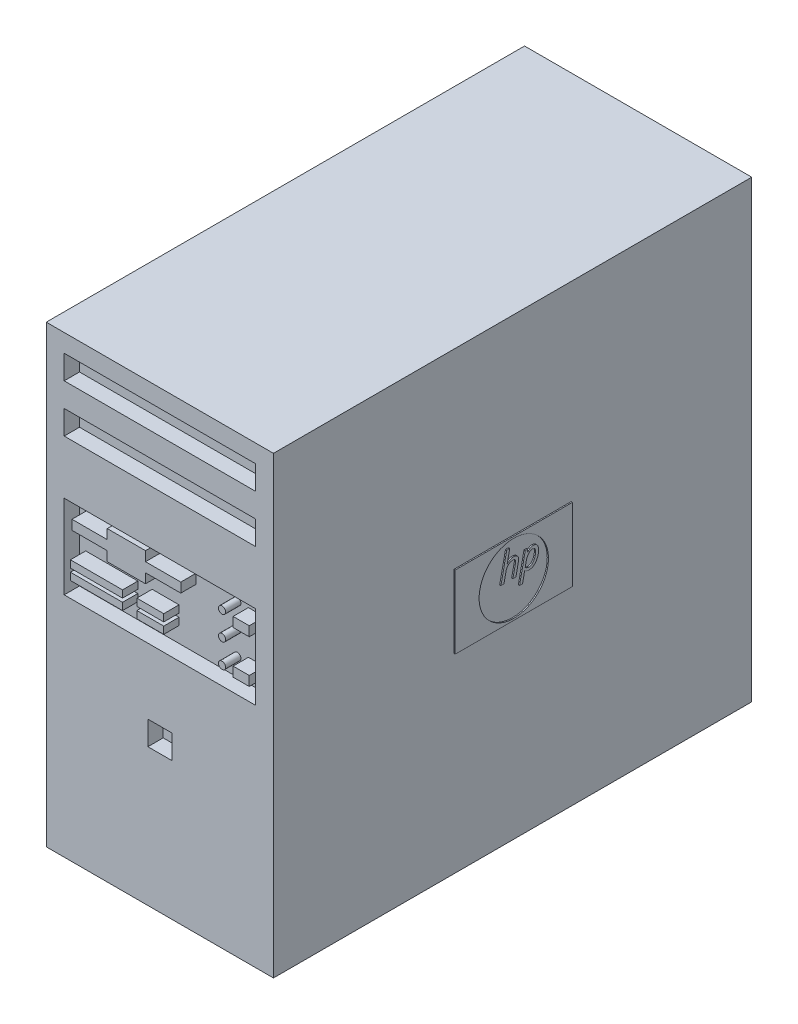
from build123d import *

# Parameters (mm, degrees)
CROQUIS1_W              = 400
CROQUIS1_H              = 380
SALIENTE_EXTRUIR1_DEPTH = 95
CROQUIS2_W              = 30.4
CROQUIS2_H              = 21.7
CROQUIS2_W_2            = 1
CROQUIS2_H_2            = 5
CORTAR_EXTRUIR1_DEPTH   = 14
CROQUIS3_W              = 45
CROQUIS3_H              = 150
CROQUIS3_W_2            = 100
CROQUIS3_H_2            = 15
SALIENTE_EXTRUIR2_DEPTH = 3
CROQUIS4_R              = 6.15
CROQUIS4_R_2            = 4
CROQUIS4_W              = 5
CROQUIS4_H              = 13
CROQUIS4_W_2            = 12
SALIENTE_EXTRUIR3_DEPTH = 5
CROQUIS5_R              = 4.1
CROQUIS5_R_2            = 5.55
SALIENTE_EXTRUIR4_DEPTH = 5
CROQUIS6_W              = 160
CROQUIS6_H              = 70
CROQUIS6_W_2            = 43.6
CROQUIS6_H_2            = 6
CROQUIS6_W_3            = 22.5
CROQUIS6_R              = 3
CROQUIS6_W_4            = 13.5
CROQUIS6_H_3            = 8
CROQUIS6_H_4            = 20
CROQUIS6_W_5            = 20
CORTAR_EXTRUIR2_DEPTH   = 12.8
ENVOLVER1_DEPTH         = 1
CROQUIS11_W             = 98
CROQUIS11_H             = 61
CROQUIS11_R             = 29
SALIENTE_EXTRUIR5_DEPTH = 1
ENVOLVER2_DEPTH         = 1
SALIENTE_EXTRUIR6_START = 1
CROQUIS13_W             = 98
CROQUIS13_H             = 61
CROQUIS13_R             = 29
SALIENTE_EXTRUIR6_DEPTH = 1


# Read off the part's stored shape, not the designer's step: Envolver1, Envolver2
with BuildPart() as part:
    # Croquis1 → Saliente-Extruir1 (new, symmetric)
    with BuildSketch(Plane(origin=(0, 0, 0), x_dir=(0, 0, -1), z_dir=(1, 0, 0))):
        Rectangle(CROQUIS1_W, CROQUIS1_H)
    extrude(amount=SALIENTE_EXTRUIR1_DEPTH, both=True)

    # Croquis2 → Cortar-Extruir1 (cut)
    # profile 1 of 5: a face of its own
    with BuildSketch(Plane(origin=(0, 0, -200), x_dir=(-1, 0, 0), z_dir=(0, 0, -1))):
        with Locations((-55, 160)):
            Rectangle(CROQUIS2_W, CROQUIS2_H)
        Polygon((-42, 151), (-68, 151), (-68, 160), (-68, 164.669872981), (-62.5, 169), (-47.5, 169), (-42, 164.669872981), (-42, 160), align=None, mode=Mode.SUBTRACT)
    # profile 2 of 5: a face of its own
    with BuildSketch(Plane(origin=(0, 0, -200), x_dir=(-1, 0, 0), z_dir=(0, 0, -1))):
        with Locations((-55, 162.856907895)):
            Rectangle(CROQUIS2_W_2, CROQUIS2_H_2)
    # profile 3 of 5: a face of its own
    with BuildSketch(Plane(origin=(0, 0, -200), x_dir=(-1, 0, 0), z_dir=(0, 0, -1))):
        with Locations((-48.5, 155)):
            Rectangle(CROQUIS2_W_2, CROQUIS2_H_2)
    # profile 4 of 5: a face of its own
    with BuildSketch(Plane(origin=(0, 0, -200), x_dir=(-1, 0, 0), z_dir=(0, 0, -1))):
        with Locations((-61.5, 155)):
            Rectangle(CROQUIS2_W_2, CROQUIS2_H_2)
    # profile 5 of 5: a face of its own
    with BuildSketch(Plane(origin=(0, 0, -200), x_dir=(-1, 0, 0), z_dir=(0, 0, -1))):
        Polygon((-85, 90), (-25, 90), (-25, -70), (30, -70), (30, -165), (-85, -165), align=None)
    extrude(amount=-CORTAR_EXTRUIR1_DEPTH, mode=Mode.SUBTRACT)

    # Croquis3 → Saliente-Extruir2 (add)
    with BuildSketch(Plane(origin=(0, 0, -186), x_dir=(-1, 0, 0), z_dir=(0, 0, -1))):
        with Locations((-58, 12.5)):
            Rectangle(CROQUIS3_W, CROQUIS3_H)
        with Locations((-22.5, -85)):
            Rectangle(CROQUIS3_W_2, CROQUIS3_H_2)
    extrude(amount=SALIENTE_EXTRUIR2_DEPTH)

    # Croquis4 → Saliente-Extruir3 (add)
    with BuildSketch(Plane(origin=(0, 0, -189), x_dir=(-1, 0, 0), z_dir=(0, 0, -1))):
        with Locations(Location((-69, 76, 0), (0, 0, 180))):
            Circle(CROQUIS4_R)
        with Locations(Location((-50, 76, 0), (0, 0, 180))):
            Circle(CROQUIS4_R)
        with Locations(Location((-68, -57.5, 0), (0, 0, 180))):
            Circle(CROQUIS4_R_2)
        with Locations(Location((-56, -57.5, 0), (0, 0, 180))):
            Circle(CROQUIS4_R_2)
        with Locations(Location((-43, -57.5, 0), (0, 0, 180))):
            Circle(CROQUIS4_R_2)
        with BuildLine():
            Line((-65.269265107, 53.441675937), (-70.469265107, 52.735154197))
            ThreePointArc((-70.469265107, 52.735154197), (-71.706408015, 52.068936991), (-72.2, 50.753363012))
            Line((-72.2, 50.753363012), (-72.2, 41.246636988))
            ThreePointArc((-72.2, 41.246636988), (-71.706408015, 39.931063009), (-70.469265107, 39.264845803))
            Line((-70.469265107, 39.264845803), (-65.269265107, 38.558324063))
            ThreePointArc((-65.269265107, 38.558324063), (-63.684426021, 39.033707234), (-63, 40.540115249))
            Line((-63, 40.540115249), (-63, 51.459884751))
            ThreePointArc((-63, 51.459884751), (-63.684426021, 52.966292766), (-65.269265107, 53.441675937))
        make_face()
        with BuildLine():
            Line((-52.36857707, 53.105891799), (-48.36857707, 53.855891799))
            ThreePointArc((-48.36857707, 53.855891799), (-46.722728326, 53.429165642), (-46, 51.890147425))
            Line((-46, 51.890147425), (-46, 16.709852575))
            ThreePointArc((-46, 16.709852575), (-46.722728326, 15.170834358), (-48.36857707, 14.744108201))
            Line((-48.36857707, 14.744108201), (-52.36857707, 15.494108201))
            ThreePointArc((-52.36857707, 15.494108201), (-53.539018216, 16.1825809), (-54, 17.459852575))
            Line((-54, 17.459852575), (-54, 51.140147425))
            ThreePointArc((-54, 51.140147425), (-53.539018216, 52.4174191), (-52.36857707, 53.105891799))
        make_face()
        with BuildLine():
            Line((-68.25, 23), (-70, 23))
            Line((-70, 23), (-70, 4))
            Line((-70, 4), (-68.25, 4))
            ThreePointArc((-68.25, 4), (-65, 0.75), (-61.75, 4))
            Line((-61.75, 4), (-60, 4))
            Line((-60, 4), (-60, 23))
            Line((-60, 23), (-61.75, 23))
            ThreePointArc((-61.75, 23), (-65, 26.25), (-68.25, 23))
        make_face()
        with Locations((-63, -13.5)):
            Rectangle(CROQUIS4_W, CROQUIS4_H)
        with Locations((-71, -13.5)):
            Rectangle(CROQUIS4_W, CROQUIS4_H)
        with Locations((-63, -40.5)):
            Rectangle(CROQUIS4_W, CROQUIS4_H)
        with Locations((-71, -40.5)):
            Rectangle(CROQUIS4_W, CROQUIS4_H)
        with BuildLine():
            Line((-46, -20.5), (-46, -6.5))
            Line((-46, -6.5), (-56, -6.5))
            Line((-56, -6.5), (-56, -20.5))
            ThreePointArc((-56, -20.5), (-51, -25.5), (-46, -20.5))
        make_face()
        with Locations((-50, -40.5)):
            Rectangle(CROQUIS4_W_2, CROQUIS4_H)
    extrude(amount=SALIENTE_EXTRUIR3_DEPTH)

    # Croquis5 → Saliente-Extruir4 (add)
    with BuildSketch(Plane(origin=(0, 0, -189), x_dir=(-1, 0, 0), z_dir=(0, 0, -1))):
        with Locations(Location((-13, -85, 0), (0, 0, 180))):
            Circle(CROQUIS5_R)
        with Locations(Location((-28, -85, 0), (0, 0, 180))):
            Circle(CROQUIS5_R_2)
        with BuildLine():
            Line((-54.378732187, -82.51492875), (-55.378732187, -86.51492875))
            ThreePointArc((-55.378732187, -86.51492875), (-55.014858063, -88.230824419), (-53.438447187, -89))
            Line((-53.438447187, -89), (-42.561552813, -89))
            ThreePointArc((-42.561552813, -89), (-40.985141937, -88.230824419), (-40.621267813, -86.51492875))
            Line((-40.621267813, -86.51492875), (-41.621267813, -82.51492875))
            ThreePointArc((-41.621267813, -82.51492875), (-42.330728394, -81.423589124), (-43.561552813, -81))
            Line((-43.561552813, -81), (-52.438447187, -81))
            ThreePointArc((-52.438447187, -81), (-53.669271606, -81.423589124), (-54.378732187, -82.51492875))
        make_face()
    extrude(amount=SALIENTE_EXTRUIR4_DEPTH)

    # Croquis6 → Cortar-Extruir2 (cut)
    # profile 1 of 4: a face of its own
    with BuildSketch(Plane.XY.offset(200)):
        with Locations((0, 35)):
            Rectangle(CROQUIS6_W, CROQUIS6_H)
        with Locations((-53, 16)):
            Rectangle(CROQUIS6_W_2, CROQUIS6_H_2, mode=Mode.SUBTRACT)
        with Locations((-53, 25)):
            Rectangle(CROQUIS6_W_2, CROQUIS6_H_2, mode=Mode.SUBTRACT)
        with Locations((-8, 16)):
            Rectangle(CROQUIS6_W_3, CROQUIS6_H_2, mode=Mode.SUBTRACT)
        with Locations((-8, 25)):
            Rectangle(CROQUIS6_W_3, CROQUIS6_H_2, mode=Mode.SUBTRACT)
        with Locations((52, 15)):
            Circle(CROQUIS6_R, mode=Mode.SUBTRACT)
        with Locations((68, 15)):
            Rectangle(CROQUIS6_W_4, CROQUIS6_H_3, mode=Mode.SUBTRACT)
        with Locations((52, 35)):
            Circle(CROQUIS6_R, mode=Mode.SUBTRACT)
        Polygon((17.5, 58), (17.5, 50), (-12, 50), (-12, 42), (-44, 42), (-44, 50), (-73.5, 50), (-73.5, 58), (-44, 58), (-44, 66), (-12, 66), (-12, 58), align=None, mode=Mode.SUBTRACT)
        with Locations((52, 55)):
            Circle(CROQUIS6_R, mode=Mode.SUBTRACT)
        with Locations((68, 51)):
            Rectangle(CROQUIS6_W_4, CROQUIS6_H_3, mode=Mode.SUBTRACT)
    # profile 2 of 4: a face of its own
    with BuildSketch(Plane.XY.offset(200)):
        with Locations((0, 165)):
            Rectangle(CROQUIS6_W, CROQUIS6_H_4)
    # profile 3 of 4: a face of its own
    with BuildSketch(Plane.XY.offset(200)):
        with Locations((0, 125)):
            Rectangle(CROQUIS6_W, CROQUIS6_H_4)
    # profile 4 of 4: a face of its own
    with BuildSketch(Plane.XY.offset(200)):
        with Locations((0, -65)):
            Rectangle(CROQUIS6_W_5, CROQUIS6_H_4)
    extrude(amount=-CORTAR_EXTRUIR2_DEPTH, mode=Mode.SUBTRACT)

    # Envolver1 outline → Envolver1 (add)
    # profile 1 of 2: a face of its own
    with BuildSketch(Plane.ZY.offset(95)):
        with BuildLine():
            add(Edge.make_bspline(
                [(7.181198595, 11.423049884), (7.337619147, 11.610028115), (7.6376853, 11.968713966), (8.140874147, 12.42272072), (8.641987971, 12.802255602), (9.155396307, 13.094519079), (9.667215756, 13.319715287), (10.181723883, 13.462802192), (10.685270473, 13.548973438), (11.017664645, 13.561747174), (11.180097426, 13.567989382)],
                knots=[0, 0, 0, 0, 0.155479612, 0.298261122, 0.43168685, 0.556135977, 0.674636922, 0.787784901, 0.896295749, 1, 1, 1, 1], degree=3))
            Line((7.181198595, 11.423049884), (7.127159422, 11.423049884))
            Line((7.127159422, 11.423049884), (7.127159422, 13.301950374))
            Line((7.127159422, 13.301950374), (5.3438667, 13.301950374))
            Line((5.3438667, 13.301950374), (1.220262084, -6.650975187))
            Line((1.220262084, -6.650975187), (3.394299598, -6.650975187))
            Line((3.394299598, -6.650975187), (4.936494469, 0.910352229))
            Line((4.936494469, 0.910352229), (4.994690502, 0.910352229))
            add(Edge.make_bspline(
                [(8.20794289, -0.266039007), (8.037368303, -0.261813107), (7.704892979, -0.253576197), (7.221505063, -0.196542189), (6.7684401, -0.094839664), (6.343961468, 0.03977446), (5.95457134, 0.215778471), (5.597588372, 0.416083364), (5.273692918, 0.642728496), (5.086822322, 0.821977863), (4.994690502, 0.910352229)],
                knots=[0, 0, 0, 0, 0.145681742, 0.283955455, 0.414883353, 0.541753133, 0.663594403, 0.779116523, 0.891098989, 1, 1, 1, 1], degree=3))
            add(Edge.make_bspline(
                [(15.012721878, 8.83748328), (15.004250511, 8.48643384), (14.987069457, 7.774459139), (14.834861884, 6.707706081), (14.59790044, 5.646762082), (14.260908987, 4.616803133), (13.834285556, 3.631406182), (13.395613861, 2.860838754), (13.005035994, 2.280892406), (12.681328192, 1.880036421), (12.336947648, 1.506549793), (11.971437125, 1.158845058), (11.579234251, 0.848141836), (11.167492604, 0.565921904), (10.727432787, 0.327664624), (10.270835212, 0.111705745), (9.788244842, -0.059209456), (9.28116875, -0.180014267), (8.751744051, -0.251088704), (8.391059336, -0.261004729), (8.20794289, -0.266039007)],
                knots=[0, 0, 0, 0, 0.083553628, 0.16945781, 0.256063076, 0.342141958, 0.427100653, 0.511322591, 0.55287012, 0.593474168, 0.633868555, 0.673780361, 0.713456906, 0.752898169, 0.792475818, 0.832480252, 0.873073575, 0.914126889, 0.956402979, 1, 1, 1, 1], degree=3))
            add(Edge.make_bspline(
                [(11.180097426, 13.567989382), (11.328512861, 13.563695426), (11.618206663, 13.555314004), (12.041419882, 13.498740974), (12.437888082, 13.392886329), (12.810101717, 13.251297268), (13.158432683, 13.073507285), (13.474120999, 12.850436773), (13.76453574, 12.595638499), (14.022727761, 12.302596699), (14.249985661, 11.975595183), (14.458177271, 11.621142722), (14.625092925, 11.228527296), (14.766751146, 10.807393506), (14.87933591, 10.357260893), (14.957655352, 9.876238233), (15.002485001, 9.36626307), (15.00925977, 9.016316389), (15.012721878, 8.83748328)],
                knots=[0, 0, 0, 0, 0.064627816, 0.126147782, 0.185416525, 0.242898704, 0.299297273, 0.355199899, 0.410766162, 0.46718409, 0.524767504, 0.583962499, 0.645836471, 0.71013394, 0.777300063, 0.84762476, 0.922131743, 1, 1, 1, 1], degree=3))
        make_face()
        with BuildLine():
            add(Edge.make_bspline(
                [(8.008413634, 1.596234045), (8.145904154, 1.599629808), (8.415650279, 1.606292041), (8.808644132, 1.676366986), (9.182576297, 1.782389573), (9.533552722, 1.939903463), (9.86569487, 2.132374959), (10.181164713, 2.352369289), (10.479057895, 2.599613416), (10.851715371, 2.968893428), (11.276868937, 3.492443722), (11.696816352, 4.201518363), (12.054807398, 4.954069366), (12.341196395, 5.734533677), (12.560295662, 6.522133876), (12.715179698, 7.300488518), (12.816713196, 8.042243173), (12.828802231, 8.522665141), (12.834527504, 8.75018923)],
                knots=[0, 0, 0, 0, 0.043484222, 0.085312793, 0.125986784, 0.166251837, 0.206733761, 0.247379355, 0.287875537, 0.329132024, 0.413332572, 0.500527523, 0.589415335, 0.676853816, 0.763384145, 0.847952988, 0.927991724, 1, 1, 1, 1], degree=3))
            add(Edge.make_bspline(
                [(5.289827526, 2.668703794), (5.455146508, 2.52803495), (5.796584391, 2.237507683), (6.293251646, 1.946364594), (6.745494846, 1.764579503), (7.132191295, 1.665068532), (7.557776914, 1.608247411), (7.854433746, 1.600338941), (8.008413634, 1.596234045)],
                knots=[0, 0, 0, 0, 0.216841357, 0.447848473, 0.571617641, 0.703367353, 0.846032665, 1, 1, 1, 1], degree=3))
            Line((5.289827526, 2.668703794), (6.087944549, 6.447289072))
            add(Edge.make_bspline(
                [(10.677117428, 11.705716329), (10.565851818, 11.702346667), (10.339699532, 11.69549768), (10.000309573, 11.617250487), (9.653879032, 11.506610607), (9.306163775, 11.347272681), (8.961703811, 11.147232042), (8.624227167, 10.908775097), (8.293885961, 10.633034006), (7.975299331, 10.316426956), (7.665794052, 9.962644536), (7.37619129, 9.566279644), (7.101936957, 9.132675475), (6.844231251, 8.664488555), (6.611288845, 8.15880278), (6.403664838, 7.620761642), (6.228607006, 7.046369076), (6.135579577, 6.650166184), (6.087944549, 6.447289072)],
                knots=[0, 0, 0, 0, 0.044593001, 0.090637253, 0.139194115, 0.19048493, 0.243825636, 0.29892729, 0.356196554, 0.416385376, 0.479082712, 0.544731655, 0.61325705, 0.68496283, 0.75913814, 0.836625524, 0.916343513, 1, 1, 1, 1], degree=3))
            add(Edge.make_bspline(
                [(12.834527504, 8.75018923), (12.831390628, 8.888755826), (12.82542331, 9.152352746), (12.800934293, 9.531094627), (12.739818088, 9.870577356), (12.667873206, 10.177591332), (12.569958338, 10.450777564), (12.45932043, 10.694398638), (12.335006997, 10.912093643), (12.143216521, 11.149004392), (11.874063349, 11.394898466), (11.493009614, 11.581232651), (11.090326605, 11.686952329), (10.814909725, 11.699459124), (10.677117428, 11.705716329)],
                knots=[0, 0, 0, 0, 0.100014081, 0.190258003, 0.273418839, 0.348582045, 0.41751, 0.482374466, 0.541525435, 0.597730836, 0.701837991, 0.801536814, 0.90070798, 1, 1, 1, 1], degree=3))
        make_face(mode=Mode.SUBTRACT)
    # profile 2 of 2: a face of its own
    with BuildSketch(Plane.ZY.offset(95)):
        with BuildLine():
            add(Edge.make_bspline(
                [(-3.140283523, 13.567989382), (-3.005761767, 13.566005865), (-2.74020578, 13.562090256), (-2.352668071, 13.519075608), (-1.981287783, 13.453093518), (-1.630598179, 13.358761202), (-1.30088264, 13.236209372), (-0.992427357, 13.097922054), (-0.711207294, 12.929787267), (-0.457531153, 12.737443588), (-0.22457297, 12.52436943), (-0.022506692, 12.282920715), (0.154695078, 12.0188772), (0.299495714, 11.730679552), (0.416631645, 11.420074631), (0.504277178, 11.088996158), (0.554499532, 10.734547341), (0.560426238, 10.492073258), (0.563478284, 10.367207573)],
                knots=[0, 0, 0, 0, 0.072973097, 0.144054341, 0.211309938, 0.277523406, 0.340802667, 0.402038509, 0.460713958, 0.518162404, 0.574562949, 0.631655979, 0.688590335, 0.746767398, 0.806261046, 0.868454294, 0.932258555, 1, 1, 1, 1], degree=3))
            add(Edge.make_bspline(
                [(-7.658789791, 11.423049884), (-7.513793623, 11.58424481), (-7.226157451, 11.904015271), (-6.739205185, 12.324390444), (-6.217945464, 12.691013876), (-5.664111131, 13.005713934), (-5.075628902, 13.255041205), (-4.457905308, 13.441843912), (-3.807436944, 13.544773894), (-3.365091176, 13.560166565), (-3.140283523, 13.567989382)],
                knots=[0, 0, 0, 0, 0.125823454, 0.249602296, 0.37262539, 0.495503629, 0.618821175, 0.743077844, 0.869427785, 1, 1, 1, 1], degree=3))
            Line((-7.658789791, 11.423049884), (-7.716985824, 11.423049884))
            Line((-7.716985824, 11.423049884), (-5.879653929, 20.218964569))
            Line((-5.879653929, 20.218964569), (-8.053691443, 20.218964569))
            Line((-8.053691443, 20.218964569), (-12.277060687, 0))
            Line((-12.277060687, 0), (-10.098866313, 0))
            Line((-10.098866313, 0), (-8.573298879, 7.291131549))
            add(Edge.make_bspline(
                [(-3.676518398, 11.705716329), (-3.830526413, 11.701783618), (-4.134292427, 11.694026721), (-4.58309524, 11.630415664), (-5.016101153, 11.522264876), (-5.430937424, 11.371175564), (-5.826939083, 11.189385814), (-6.199260733, 10.971059061), (-6.549894386, 10.720679786), (-6.8779758, 10.437981763), (-7.181573049, 10.125494912), (-7.460173552, 9.786186099), (-7.720583931, 9.425251848), (-7.947598233, 9.034247904), (-8.144429803, 8.622480418), (-8.323455572, 8.197355838), (-8.462797712, 7.750887184), (-8.536227129, 7.445373776), (-8.573298879, 7.291131549)],
                knots=[0, 0, 0, 0, 0.064582355, 0.127382492, 0.189691172, 0.251466219, 0.312318356, 0.372230549, 0.432230079, 0.492815148, 0.553647851, 0.614746539, 0.676840684, 0.740141804, 0.804090713, 0.868205816, 0.933462075, 1, 1, 1, 1], degree=3))
            add(Edge.make_bspline(
                [(-1.668755263, 9.860070715), (-1.674166758, 10.014881615), (-1.684344305, 10.306038769), (-1.805255824, 10.704609), (-1.983758967, 11.035575747), (-2.229455275, 11.291789226), (-2.527473092, 11.484701326), (-2.875453214, 11.613359409), (-3.264112316, 11.693595956), (-3.536156285, 11.701591169), (-3.676518398, 11.705716329)],
                knots=[0, 0, 0, 0, 0.148916788, 0.280071933, 0.398003961, 0.50866924, 0.618824369, 0.737775446, 0.864704252, 1, 1, 1, 1], degree=3))
            add(Edge.make_bspline(
                [(-1.905696254, 8.122503447), (-1.881339111, 8.234581577), (-1.835450199, 8.445737018), (-1.783052934, 8.744282795), (-1.739469423, 9.004550546), (-1.703971312, 9.285845719), (-1.674869429, 9.567079416), (-1.670549109, 9.774109513), (-1.668755263, 9.860070715)],
                knots=[0, 0, 0, 0, 0.195855155, 0.368991538, 0.517605008, 0.646460244, 0.853206356, 1, 1, 1, 1], degree=3))
            Line((-1.905696254, 8.122503447), (-3.605851787, 0))
            Line((-3.605851787, 0), (-1.431814272, 0))
            Line((-1.431814272, 0), (0.239243244, 7.960385927))
            add(Edge.make_bspline(
                [(0.563478284, 10.367207573), (0.559993208, 10.179908591), (0.552793085, 9.792951286), (0.47374218, 9.201268178), (0.37169378, 8.585871648), (0.283780644, 8.170709789), (0.239243244, 7.960385927)],
                knots=[0, 0, 0, 0, 0.230804658, 0.476839474, 0.734963269, 1, 1, 1, 1], degree=3))
        make_face()
    extrude(amount=ENVOLVER1_DEPTH)

    # Croquis11 → Saliente-Extruir5 (add)
    with BuildSketch(Plane.ZY.offset(95)):
        Rectangle(CROQUIS11_W, CROQUIS11_H)
        Circle(CROQUIS11_R, mode=Mode.SUBTRACT)
    extrude(amount=SALIENTE_EXTRUIR5_DEPTH)

    # Envolver2 outline → Envolver2 (add)
    # profile 1 of 2: a face of its own
    with BuildSketch(Plane(origin=(95, 0, 0), x_dir=(0, 0, -1), z_dir=(1, 0, 0))):
        with BuildLine():
            add(Edge.make_bspline(
                [(11.702671829, 13.200635453), (11.883433595, 13.4167101), (12.23019422, 13.831212463), (12.811686255, 14.355868987), (13.390780365, 14.79446478), (13.984082185, 15.132208522), (14.575547865, 15.392448395), (15.170120619, 15.557801614), (15.752026067, 15.657382305), (16.1361454, 15.672143812), (16.323854982, 15.679357394)],
                knots=[0, 0, 0, 0, 0.155479612, 0.298261122, 0.43168685, 0.556135977, 0.674636922, 0.787784901, 0.896295749, 1, 1, 1, 1], degree=3))
            Line((11.702671829, 13.200635453), (11.640223408, 13.200635453))
            Line((11.640223408, 13.200635453), (11.640223408, 15.371919014))
            Line((11.640223408, 15.371919014), (9.579425515, 15.371919014))
            Line((9.579425515, 15.371919014), (4.814130621, -7.685959507))
            Line((4.814130621, -7.685959507), (7.326478634, -7.685959507))
            Line((7.326478634, -7.685959507), (9.108660495, 1.052015708))
            Line((9.108660495, 1.052015708), (9.175912641, 1.052015708))
            add(Edge.make_bspline(
                [(12.889191828, -0.30743838), (12.692073461, -0.302554871), (12.307860348, -0.293036183), (11.749250544, -0.227126889), (11.225682367, -0.109598035), (10.73514895, 0.04596392), (10.285164298, 0.249356605), (9.872629811, 0.480831728), (9.498331716, 0.742745997), (9.282381454, 0.94988906), (9.175912641, 1.052015708)],
                knots=[0, 0, 0, 0, 0.145681742, 0.283955455, 0.414883353, 0.541753133, 0.663594403, 0.779116523, 0.891098989, 1, 1, 1, 1], degree=3))
            add(Edge.make_bspline(
                [(20.752889148, 10.212718695), (20.743099518, 9.807041075), (20.723244854, 8.984273201), (20.547351664, 7.751518518), (20.273515721, 6.525476865), (19.884083707, 5.335241965), (19.391071731, 4.196503533), (18.884136614, 3.306025087), (18.432779394, 2.635831014), (18.058698153, 2.172596258), (17.660727202, 1.740989912), (17.238338153, 1.339177481), (16.785103053, 0.980124512), (16.309288674, 0.65398723), (15.800749425, 0.378653801), (15.273098911, 0.129088714), (14.715410762, -0.068423272), (14.129426571, -0.208026993), (13.51761602, -0.290161601), (13.100803742, -0.301620698), (12.889191828, -0.30743838)],
                knots=[0, 0, 0, 0, 0.083553628, 0.16945781, 0.256063076, 0.342141958, 0.427100653, 0.511322591, 0.55287012, 0.593474168, 0.633868555, 0.673780361, 0.713456906, 0.752898169, 0.792475818, 0.832480252, 0.873073575, 0.914126889, 0.956402979, 1, 1, 1, 1], degree=3))
            add(Edge.make_bspline(
                [(16.323854982, 15.679357394), (16.495365924, 15.674395239), (16.830140114, 15.664709551), (17.319211202, 15.599332971), (17.777375372, 15.477005869), (18.207510631, 15.313383579), (18.610046743, 15.107927), (18.974860556, 14.850143612), (19.310467873, 14.555695179), (19.608838166, 14.217051997), (19.871460559, 13.839164493), (20.112049682, 13.429554295), (20.304939735, 12.975842444), (20.468641946, 12.489174373), (20.598746467, 11.96899486), (20.689253505, 11.413118378), (20.741059271, 10.823783981), (20.748888288, 10.419380725), (20.752889148, 10.212718695)],
                knots=[0, 0, 0, 0, 0.064627816, 0.126147782, 0.185416525, 0.242898704, 0.299297273, 0.355199899, 0.410766162, 0.46718409, 0.524767504, 0.583962499, 0.645836471, 0.71013394, 0.777300063, 0.84762476, 0.922131743, 1, 1, 1, 1], degree=3))
        make_face()
        with BuildLine():
            add(Edge.make_bspline(
                [(12.658613042, 1.844630282), (12.817499001, 1.848554473), (13.129221379, 1.856253442), (13.583370545, 1.937233024), (14.01549176, 2.059754202), (14.421085002, 2.241779445), (14.804913092, 2.464202185), (15.169474434, 2.718430695), (15.513723942, 3.00414945), (15.944372108, 3.430894572), (16.435685487, 4.035916579), (16.920982565, 4.855333105), (17.334682002, 5.72499152), (17.665637114, 6.626906941), (17.918831276, 7.537068694), (18.097817423, 8.436546154), (18.215150947, 9.293728158), (18.229121205, 9.848910472), (18.23573741, 10.111840476)],
                knots=[0, 0, 0, 0, 0.043484222, 0.085312793, 0.125986784, 0.166251837, 0.206733761, 0.247379355, 0.287875537, 0.329132024, 0.413332572, 0.500527523, 0.589415335, 0.676853816, 0.763384145, 0.847952988, 0.927991724, 1, 1, 1, 1], degree=3))
            add(Edge.make_bspline(
                [(9.516977094, 3.083991252), (9.708022011, 2.921432378), (10.102592381, 2.585695025), (10.676547974, 2.249246018), (11.199166511, 2.039172637), (11.64603831, 1.924176373), (12.137850976, 1.858513095), (12.48067174, 1.849373956), (12.658613042, 1.844630282)],
                knots=[0, 0, 0, 0, 0.216841357, 0.447848473, 0.571617641, 0.703367353, 0.846032665, 1, 1, 1, 1], degree=3))
            Line((9.516977094, 3.083991252), (10.439292235, 7.450576997))
            add(Edge.make_bspline(
                [(15.742604295, 13.527288732), (15.614024208, 13.523394704), (15.352679477, 13.515479919), (14.960475717, 13.425056374), (14.560135762, 13.297199388), (14.15831117, 13.113066262), (13.760248441, 12.881896515), (13.370255733, 12.606332351), (12.988508837, 12.287682108), (12.620345693, 11.921806594), (12.262677084, 11.512970705), (11.928008101, 11.054925918), (11.611075977, 10.553846905), (11.313267675, 10.012803583), (11.044076189, 9.428426062), (10.804142996, 8.806658233), (10.601843729, 8.142882189), (10.494339937, 7.685024612), (10.439292235, 7.450576997)],
                knots=[0, 0, 0, 0, 0.044593001, 0.090637253, 0.139194115, 0.19048493, 0.243825636, 0.29892729, 0.356196554, 0.416385376, 0.479082712, 0.544731655, 0.61325705, 0.68496283, 0.75913814, 0.836625524, 0.916343513, 1, 1, 1, 1], degree=3))
            add(Edge.make_bspline(
                [(18.23573741, 10.111840476), (18.232112392, 10.271969963), (18.225216476, 10.576586233), (18.196916628, 11.014265622), (18.12628989, 11.40657659), (18.043149383, 11.761366214), (17.929997599, 12.077064027), (17.802142892, 12.358595931), (17.658484558, 12.610167309), (17.436848814, 12.883944669), (17.125811663, 13.168103283), (16.685460662, 13.383433661), (16.220114571, 13.505604793), (15.901838992, 13.520057819), (15.742604295, 13.527288732)],
                knots=[0, 0, 0, 0, 0.100014081, 0.190258003, 0.273418839, 0.348582045, 0.41751, 0.482374466, 0.541525435, 0.597730836, 0.701837991, 0.801536814, 0.90070798, 1, 1, 1, 1], degree=3))
        make_face(mode=Mode.SUBTRACT)
    # profile 2 of 2: a face of its own
    with BuildSketch(Plane(origin=(95, 0, 0), x_dir=(0, 0, -1), z_dir=(1, 0, 0))):
        with BuildLine():
            add(Edge.make_bspline(
                [(-0.224976581, 15.679357394), (-0.069521367, 15.677065215), (0.237358828, 15.672540282), (0.685202799, 15.622831957), (1.114375029, 15.546582135), (1.519636817, 15.437570397), (1.900660684, 15.295947797), (2.257115902, 15.136141047), (2.582097722, 14.941842147), (2.875249402, 14.719567114), (3.14445912, 14.473335651), (3.377969724, 14.194314155), (3.582746556, 13.889181793), (3.750080186, 13.55613658), (3.885444099, 13.19719721), (3.986728497, 12.814598318), (4.044766149, 12.404992331), (4.051615132, 12.124785906), (4.055142119, 11.980489382)],
                knots=[0, 0, 0, 0, 0.072973097, 0.144054341, 0.211309938, 0.277523406, 0.340802667, 0.402038509, 0.460713958, 0.518162404, 0.574562949, 0.631655979, 0.688590335, 0.746767398, 0.806261046, 0.868454294, 0.932258555, 1, 1, 1, 1], degree=3))
            add(Edge.make_bspline(
                [(-5.446625321, 13.200635453), (-5.279065731, 13.386914554), (-4.946669367, 13.75644575), (-4.38394055, 14.242237151), (-3.781565561, 14.665912293), (-3.141546896, 15.029584061), (-2.46148864, 15.317710125), (-1.747638656, 15.533581934), (-0.995948361, 15.652529254), (-0.484767434, 15.670317238), (-0.224976581, 15.679357394)],
                knots=[0, 0, 0, 0, 0.125823454, 0.249602296, 0.37262539, 0.495503629, 0.618821175, 0.743077844, 0.869427785, 1, 1, 1, 1], degree=3))
            Line((-5.446625321, 13.200635453), (-5.513877467, 13.200635453))
            Line((-5.513877467, 13.200635453), (-3.390631153, 23.365316901))
            Line((-3.390631153, 23.365316901), (-5.902979167, 23.365316901))
            Line((-5.902979167, 23.365316901), (-10.783563454, 0))
            Line((-10.783563454, 0), (-8.266411716, 0))
            Line((-8.266411716, 0), (-6.503444754, 8.42573311))
            add(Edge.make_bspline(
                [(-0.844657067, 13.527288732), (-1.022630872, 13.522744036), (-1.373667107, 13.513780059), (-1.892309885, 13.440270236), (-2.392697545, 13.31528968), (-2.872088115, 13.140688768), (-3.329713144, 12.930610002), (-3.759973225, 12.678308567), (-4.165170355, 12.388966791), (-4.544305805, 12.062277021), (-4.895147011, 11.701162866), (-5.217101631, 11.309052878), (-5.51803549, 10.891952234), (-5.780376377, 10.440102634), (-6.007837679, 9.964258395), (-6.21472235, 9.472978512), (-6.375748067, 8.957033122), (-6.460604123, 8.603977574), (-6.503444754, 8.42573311)],
                knots=[0, 0, 0, 0, 0.064582355, 0.127382492, 0.189691172, 0.251466219, 0.312318356, 0.372230549, 0.432230079, 0.492815148, 0.553647851, 0.614746539, 0.676840684, 0.740141804, 0.804090713, 0.868205816, 0.933462075, 1, 1, 1, 1], degree=3))
            add(Edge.make_bspline(
                [(1.47554196, 11.394434969), (1.469288361, 11.5733366), (1.457527046, 11.90980186), (1.317800012, 12.370395167), (1.111519295, 12.752864948), (0.827589222, 13.04894881), (0.483195684, 13.271880718), (0.081065011, 13.42055979), (-0.368074858, 13.51328226), (-0.682452655, 13.52252164), (-0.844657067, 13.527288732)],
                knots=[0, 0, 0, 0, 0.148916788, 0.280071933, 0.398003961, 0.50866924, 0.618824369, 0.737775446, 0.864704252, 1, 1, 1, 1], degree=3))
            add(Edge.make_bspline(
                [(1.201729652, 9.386478048), (1.229877106, 9.515997095), (1.282906971, 9.760011262), (1.34345798, 10.105014918), (1.393823692, 10.405783953), (1.434845803, 10.73085257), (1.468476344, 11.055850146), (1.473468967, 11.295097008), (1.47554196, 11.394434969)],
                knots=[0, 0, 0, 0, 0.195855155, 0.368991538, 0.517605008, 0.646460244, 0.853206356, 1, 1, 1, 1], degree=3))
            Line((1.201729652, 9.386478048), (-0.762993747, 0))
            Line((-0.762993747, 0), (1.749354267, 0))
            Line((1.749354267, 0), (3.680451593, 9.199132785))
            add(Edge.make_bspline(
                [(4.055142119, 11.980489382), (4.051114717, 11.764044071), (4.042794155, 11.316870823), (3.951441828, 10.633113587), (3.833513277, 9.921952791), (3.731919634, 9.442185968), (3.680451593, 9.199132785)],
                knots=[0, 0, 0, 0, 0.230804658, 0.476839474, 0.734963269, 1, 1, 1, 1], degree=3))
        make_face()
    extrude(amount=ENVOLVER2_DEPTH)

    # Croquis13 → Saliente-Extruir6 (add)
    with BuildSketch(Plane(origin=(95, 0, 0), x_dir=(0, 0, -1), z_dir=(1, 0, 0)).offset(SALIENTE_EXTRUIR6_START)):
        Rectangle(CROQUIS13_W, CROQUIS13_H)
        with Locations(Location((0, 0, 0), (0, 0, 180))):
            Circle(CROQUIS13_R, mode=Mode.SUBTRACT)
    extrude(amount=-SALIENTE_EXTRUIR6_DEPTH)


solid = part.part
